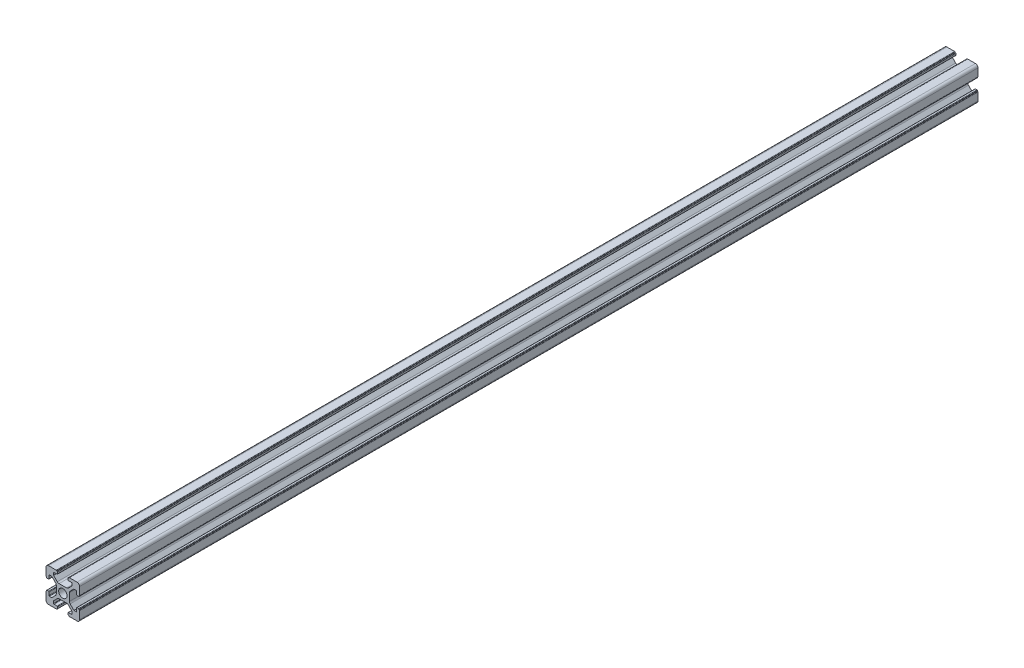
from build123d import *

# Parameters (mm, degrees)
BOSS_EXTRUDE1_DEPTH = 534.2
F_3DSKETCH2_R       = 2.5
CUT_EXTRUDE1_DEPTH  = 535.387226714


with BuildPart() as part:
    # Sketch1 → Boss-Extrude1 (new body)
    with BuildSketch(Plane.XY):
        with BuildLine():
            ThreePointArc((-4.339541497, 3.27832502), (-4.01438237, 2.791689997), (-3.900201668, 2.217664848))
            Line((-3.900201668, 2.217664848), (-3.900201668, -2.220777458))
            ThreePointArc((-3.900201668, -2.220777458), (-4.013982246, -2.793835668), (-4.338062619, -3.279956687))
            ThreePointArc((-4.338062619, -3.279956687), (-4.338801799, -3.280697416), (-4.339541497, -3.28143763))
            Line((-4.339541497, -3.28143763), (-6.559305445, -5.501201578))
            Line((-6.559305445, -5.501201578), (-7.918645273, -5.501201578))
            ThreePointArc((-7.918645273, -5.501201578), (-8.116635172, -5.419191476), (-8.198645273, -5.221201578))
            Line((-8.198645273, -5.221201578), (-8.198645273, -3.381201578))
            ThreePointArc((-8.198645273, -3.381201578), (-8.280655374, -3.183211679), (-8.478645273, -3.101201578))
            Line((-8.478645273, -3.101201578), (-9.418645273, -3.101201578))
            ThreePointArc((-9.418645273, -3.101201578), (-9.616635172, -3.183211679), (-9.698645273, -3.381201578))
            Line((-9.698645273, -3.381201578), (-9.698645273, -3.601201578))
            Line((-9.698645273, -3.601201578), (-9.718645273, -3.601201578))
            ThreePointArc((-9.718645273, -3.601201578), (-9.916635172, -3.683211679), (-9.998645273, -3.881201578))
            Line((-9.998645273, -3.881201578), (-9.998645273, -8.501201578))
            ThreePointArc((-9.998645273, -8.501201578), (-9.559305445, -9.561861749), (-8.498645273, -10.001201578))
            Line((-8.498645273, -10.001201578), (-3.878645273, -10.001201578))
            ThreePointArc((-3.878645273, -10.001201578), (-3.680655374, -9.919191476), (-3.598645273, -9.721201578))
            Line((-3.598645273, -9.721201578), (-3.598645273, -9.701201578))
            Line((-3.598645273, -9.701201578), (-3.378645273, -9.701201578))
            ThreePointArc((-3.378645273, -9.701201578), (-3.180655374, -9.619191476), (-3.098645273, -9.421201578))
            Line((-3.098645273, -9.421201578), (-3.098645273, -8.481201578))
            ThreePointArc((-3.098645273, -8.481201578), (-3.180655374, -8.283211679), (-3.378645273, -8.201201578))
            Line((-3.378645273, -8.201201578), (-5.218645273, -8.201201578))
            ThreePointArc((-5.218645273, -8.201201578), (-5.416635172, -8.119191476), (-5.498645273, -7.921201578))
            Line((-5.498645273, -7.921201578), (-5.498645273, -6.561861749))
            Line((-5.498645273, -6.561861749), (-3.277324929, -4.340541406))
            ThreePointArc((-3.277324929, -4.340541406), (-2.790689906, -4.015382279), (-2.216664757, -3.901201578))
            Line((-2.216664757, -3.901201578), (2.234977304, -3.899793498))
            ThreePointArc((2.234977304, -3.899793498), (2.801097117, -4.016727825), (3.280957809, -4.339061494))
            Line((3.280957809, -4.339061494), (5.502201668, -6.560305354))
            Line((5.502201668, -6.560305354), (5.502201668, -7.919645182))
            ThreePointArc((5.502201668, -7.919645182), (5.420191567, -8.117635081), (5.222201668, -8.199645182))
            Line((5.222201668, -8.199645182), (3.382201668, -8.199645182))
            ThreePointArc((3.382201668, -8.199645182), (3.18421177, -8.281655283), (3.102201668, -8.479645182))
            Line((3.102201668, -8.479645182), (3.102201668, -9.419645182))
            ThreePointArc((3.102201668, -9.419645182), (3.18421177, -9.617635081), (3.382201668, -9.699645182))
            Line((3.382201668, -9.699645182), (3.602201668, -9.699645182))
            Line((3.602201668, -9.699645182), (3.602201668, -9.719645182))
            ThreePointArc((3.602201668, -9.719645182), (3.68421177, -9.917635081), (3.882201668, -9.999645182))
            Line((3.882201668, -9.999645182), (8.502201668, -9.999645182))
            ThreePointArc((8.502201668, -9.999645182), (9.56286184, -9.560305354), (10.002201668, -8.499645182))
            Line((10.002201668, -8.499645182), (10.002201668, -3.879645182))
            ThreePointArc((10.002201668, -3.879645182), (9.920191567, -3.681655283), (9.722201668, -3.599645182))
            Line((9.722201668, -3.599645182), (9.702201668, -3.599645182))
            Line((9.702201668, -3.599645182), (9.702201668, -3.379645182))
            ThreePointArc((9.702201668, -3.379645182), (9.620191567, -3.181655283), (9.422201668, -3.099645182))
            Line((9.422201668, -3.099645182), (8.482201668, -3.099645182))
            ThreePointArc((8.482201668, -3.099645182), (8.28421177, -3.181655283), (8.202201668, -3.379645182))
            Line((8.202201668, -3.379645182), (8.202201668, -5.219645182))
            ThreePointArc((8.202201668, -5.219645182), (8.120191567, -5.417635081), (7.922201668, -5.499645182))
            Line((7.922201668, -5.499645182), (6.56286184, -5.499645182))
            Line((6.56286184, -5.499645182), (4.341541497, -3.278324838))
            ThreePointArc((4.341541497, -3.278324838), (4.01638237, -2.791689815), (3.902201668, -2.217664667))
            Line((3.902201668, -2.217664667), (3.900793589, 2.233977395))
            ThreePointArc((3.900793589, 2.233977395), (4.017727916, 2.800097207), (4.340061585, 3.2799579))
            Line((4.340061585, 3.2799579), (6.561305445, 5.501201759))
            Line((6.561305445, 5.501201759), (7.920645273, 5.501201759))
            ThreePointArc((7.920645273, 5.501201759), (8.118635172, 5.419191658), (8.200645273, 5.221201759))
            Line((8.200645273, 5.221201759), (8.200645273, 3.381201759))
            ThreePointArc((8.200645273, 3.381201759), (8.282655374, 3.183211861), (8.480645273, 3.101201759))
            Line((8.480645273, 3.101201759), (9.420645273, 3.101201759))
            ThreePointArc((9.420645273, 3.101201759), (9.618635172, 3.183211861), (9.700645273, 3.381201759))
            Line((9.700645273, 3.381201759), (9.700645273, 3.601201759))
            Line((9.700645273, 3.601201759), (9.720645273, 3.601201759))
            ThreePointArc((9.720645273, 3.601201759), (9.918635172, 3.683211861), (10.000645273, 3.881201759))
            Line((10.000645273, 3.881201759), (10.000645273, 8.501201759))
            ThreePointArc((10.000645273, 8.501201759), (9.561305445, 9.561861931), (8.500645273, 10.001201759))
            Line((8.500645273, 10.001201759), (3.880645273, 10.001201759))
            ThreePointArc((3.880645273, 10.001201759), (3.682655374, 9.919191658), (3.600645273, 9.721201759))
            Line((3.600645273, 9.721201759), (3.600645273, 9.701201759))
            Line((3.600645273, 9.701201759), (3.380645273, 9.701201759))
            ThreePointArc((3.380645273, 9.701201759), (3.182655374, 9.619191658), (3.100645273, 9.421201759))
            Line((3.100645273, 9.421201759), (3.100645273, 8.481201759))
            ThreePointArc((3.100645273, 8.481201759), (3.182655374, 8.283211861), (3.380645273, 8.201201759))
            Line((3.380645273, 8.201201759), (5.220645273, 8.201201759))
            ThreePointArc((5.220645273, 8.201201759), (5.418635172, 8.119191658), (5.500645273, 7.921201759))
            Line((5.500645273, 7.921201759), (5.500645273, 6.561861931))
            Line((5.500645273, 6.561861931), (3.279324929, 4.340541588))
            ThreePointArc((3.279324929, 4.340541588), (2.792689906, 4.015382461), (2.218664757, 3.901201759))
            Line((2.218664757, 3.901201759), (-2.232977304, 3.89979368))
            ThreePointArc((-2.232977304, 3.89979368), (-2.799097117, 4.016728006), (-3.278957809, 4.339061676))
            Line((-3.278957809, 4.339061676), (-5.500201668, 6.560305535))
            Line((-5.500201668, 6.560305535), (-5.500201668, 7.919645364))
            ThreePointArc((-5.500201668, 7.919645364), (-5.418191567, 8.117635262), (-5.220201668, 8.199645364))
            Line((-5.220201668, 8.199645364), (-3.380201668, 8.199645364))
            ThreePointArc((-3.380201668, 8.199645364), (-3.18221177, 8.281655465), (-3.100201668, 8.479645364))
            Line((-3.100201668, 8.479645364), (-3.100201668, 9.419645364))
            ThreePointArc((-3.100201668, 9.419645364), (-3.18221177, 9.617635262), (-3.380201668, 9.699645364))
            Line((-3.380201668, 9.699645364), (-3.600201668, 9.699645364))
            Line((-3.600201668, 9.699645364), (-3.600201668, 9.719645364))
            ThreePointArc((-3.600201668, 9.719645364), (-3.68221177, 9.917635262), (-3.880201668, 9.999645364))
            Line((-3.880201668, 9.999645364), (-8.500201668, 9.999645364))
            ThreePointArc((-8.500201668, 9.999645364), (-9.56086184, 9.560305535), (-10.000201668, 8.499645364))
            Line((-10.000201668, 8.499645364), (-10.000201668, 3.879645364))
            ThreePointArc((-10.000201668, 3.879645364), (-9.918191567, 3.681655465), (-9.720201668, 3.599645364))
            Line((-9.720201668, 3.599645364), (-9.700201668, 3.599645364))
            Line((-9.700201668, 3.599645364), (-9.700201668, 3.379645364))
            ThreePointArc((-9.700201668, 3.379645364), (-9.618191567, 3.181655465), (-9.420201668, 3.099645364))
            Line((-9.420201668, 3.099645364), (-8.480201668, 3.099645364))
            ThreePointArc((-8.480201668, 3.099645364), (-8.28221177, 3.181655465), (-8.200201668, 3.379645364))
            Line((-8.200201668, 3.379645364), (-8.200201668, 5.219645364))
            ThreePointArc((-8.200201668, 5.219645364), (-8.118191567, 5.417635262), (-7.920201668, 5.499645364))
            Line((-7.920201668, 5.499645364), (-6.56086184, 5.499645364))
            Line((-6.56086184, 5.499645364), (-4.339541497, 3.27832502))
        make_face()
    extrude(amount=BOSS_EXTRUDE1_DEPTH)

    # 3DSketch2 → Cut-Extrude1 (cut, through all)
    with BuildSketch(Plane.XY):
        Circle(F_3DSKETCH2_R)
    extrude(amount=CUT_EXTRUDE1_DEPTH, mode=Mode.SUBTRACT)


solid = part.part
